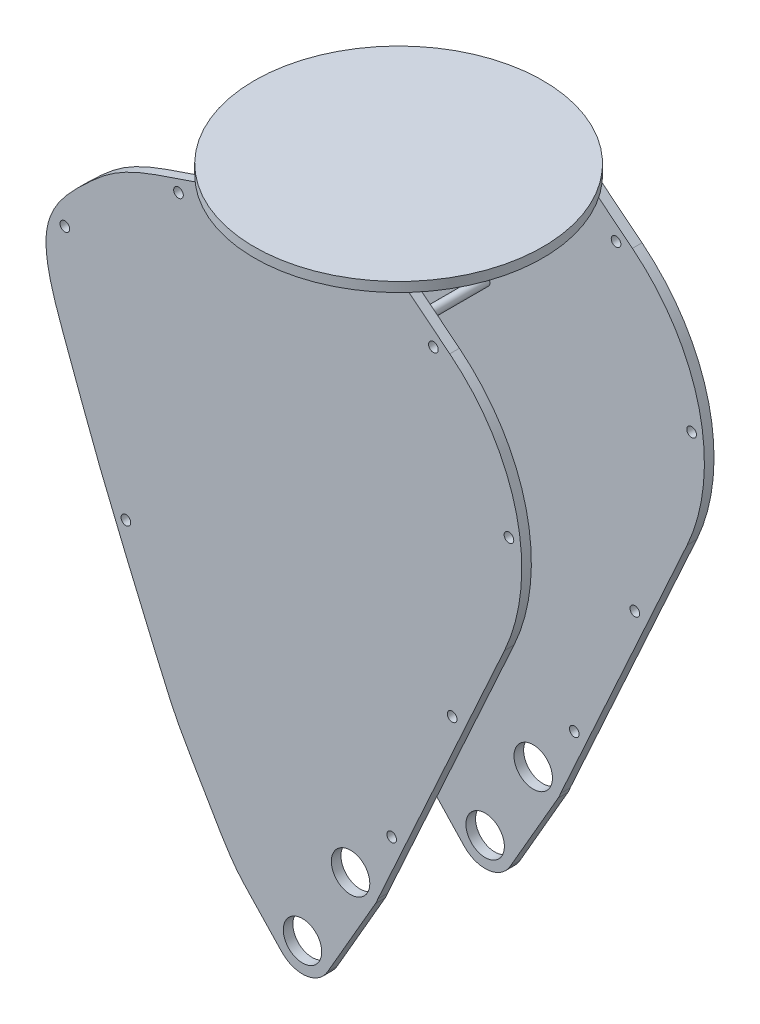
from build123d import *

# Parameters (mm, degrees)
SKETCH_1_R               = 10
EXTRUDE_1_DEPTH          = 100
EXTRUDE_START            = -100
SKETCH_2_R               = 10
EXTRUDE_2_DEPTH          = 100
EXTRUDE_6_DEPTH          = 100
CUT_EXTRUDE_1_DEPTH      = 547.260522505
CUT_EXTRUDE_1_DEPTH_BACK = 547.260522505
SKETCH_3_W               = 90
SKETCH_3_H               = 380
SKETCH_5_R               = 2.5
EXTRUDE_3_DEPTH          = 100
SKETCH_6_W               = 191.177045066
SKETCH_6_H               = 235.084722287
CUT_EXTRUDE_2_DEPTH      = 84
SKETCH_7_R               = 75
EXTRUDE_4_DEPTH          = 5
FILLET_1_R               = 100
CUT_EXTRUDE_3_DEPTH      = 372.245990354
CUT_EXTRUDE_3_DEPTH_BACK = 372.245990354
SKETCH_9_R               = 2.5


# Read off the part's stored shape, not the designer's step: 凸台-拉伸6
with BuildPart() as part:
    # 草图1 → 凸台-拉伸1 (new body)
    with BuildSketch(Plane.XY):
        with BuildLine():
            Line((-15, 500), (-15, 0))
            ThreePointArc((-15, 0), (0, -15), (15, 0))
            Line((15, 0), (15, 500))
            ThreePointArc((15, 500), (0, 515), (-15, 500))
        make_face()
        with Locations((0, 500)):
            Circle(SKETCH_1_R, mode=Mode.SUBTRACT)
        Circle(SKETCH_1_R, mode=Mode.SUBTRACT)
    extrude(amount=EXTRUDE_1_DEPTH)

    # 草图2 → 凸台-拉伸2 (add)
    with BuildSketch(Plane.XY.offset(100).offset(EXTRUDE_START)):
        with BuildLine():
            Line((15, 58.301270189), (25, 58.301270189))
            ThreePointArc((25, 58.301270189), (37.990381057, 50.801270189), (37.990381057, 35.801270189))
            Line((37.990381057, 35.801270189), (12.990381057, -7.5))
            ThreePointArc((12.990381057, -7.5), (-3.882285677, -14.488887394), (-15, 0))
            Line((-15, 0), (-15, 58.301270189))
            Line((-15, 58.301270189), (15, 58.301270189))
        make_face()
        with Locations((25, 43.301270189)):
            Circle(SKETCH_2_R, mode=Mode.SUBTRACT)
        Circle(SKETCH_2_R, mode=Mode.SUBTRACT)
    extrude(amount=EXTRUDE_2_DEPTH)

    # 凸台-拉伸6 outline → 凸台-拉伸6 (add)
    with BuildSketch(Plane(origin=(0, 0, 0), x_dir=(-1, 0, 0), z_dir=(0, 0, -1)).offset(EXTRUDE_START)):
        with BuildLine():
            add(Edge.make_bspline(
                [(38.612780637, 320), (75.136043423, 306.586029444), (91.064136582, 304.603219665), (118.984001014, 278.973676733), (129.662077412, 267.968974065), (136.038640467, 242.70657755), (120.359514298, 200.44999402), (109.589031887, 171.214421453), (103.269394168, 155.375414082), (89.549210595, 121.677121722), (65.725886592, 66.828536865), (62.106981873, 60.722826423), (38.372965569, 20.119833015), (32.80466093, 12.939929061), (30.288618585, 10.269952061)],
                knots=[0, 0, 0, 0, 0.244208219, 0.271127101, 0.397158822, 0.431429532, 0.59808024, 0.828922037, 0.865497992, 0.952912921, 0.966817851, 0.990642362, 0.993870231, 0.996118484, 0.996118484, 0.996118484, 0.996118484], degree=3))
            Line((38.612780637, 320), (15, 320))
            Line((15, 320), (15, 0))
            ThreePointArc((15, 0), (13.941832406, -5.534013839), (10.916625444, -10.28723913))
            Line((10.916625444, -10.28723913), (30.288618585, 10.269952061))
        make_face()
        with BuildLine():
            Line((-15, 58.301270189), (-15, 320))
            Line((-15, 320), (-55, 320))
            Line((-55, 320), (-137.235207142, 254.038677195))
            Line((-137.235207142, 254.038677195), (-39.190607966, 38.440545392))
            ThreePointArc((-39.190607966, 38.440545392), (-37.204730066, 52.021623624), (-25, 58.301270189))
            Line((-25, 58.301270189), (-15, 58.301270189))
        make_face()
    extrude(amount=EXTRUDE_6_DEPTH)

    # 草图3 → 切除-拉伸1 (cut, two sides: drawn at the far end of the back side and taken through both)
    with BuildSketch(Plane.ZY.offset(15).offset(-CUT_EXTRUDE_1_DEPTH_BACK)):
        with Locations((50, 150)):
            Rectangle(SKETCH_3_W, SKETCH_3_H)
    extrude(amount=CUT_EXTRUDE_1_DEPTH + CUT_EXTRUDE_1_DEPTH_BACK, mode=Mode.SUBTRACT)

    # 草图5 → 凸台-拉伸3 (add)
    with BuildSketch(Plane.XY.offset(100)):
        with Locations(Location((0, 250, 0), (0, 0, 270))):
            Circle(SKETCH_5_R)
    extrude(amount=-EXTRUDE_3_DEPTH)

    # 草图6 → 切除-拉伸2 (cut)
    with BuildSketch(Plane(origin=(15, 0, 0), x_dir=(0, 0, -1), z_dir=(1, 0, 0))):
        with Locations((-50.962374235, 437.542361144)):
            Rectangle(SKETCH_6_W, SKETCH_6_H)
    extrude(amount=-CUT_EXTRUDE_2_DEPTH, mode=Mode.SUBTRACT)

    # 草图7 → 凸台-拉伸4 (add)
    with BuildSketch(Plane(origin=(0, 320, 0), x_dir=(1, 0, 0), z_dir=(0, 1, 0))):
        with Locations(Location((0, -50, 0), (0, 0, 180))):
            Circle(SKETCH_7_R)
    extrude(amount=EXTRUDE_4_DEPTH)

    # 圆角1
    fillet_1_edges = [part.edges().sort_by_distance(p)[0] for p in [
        (137.235207142, 254.038677195, 97.5),
        (137.235207142, 254.038677195, 2.5),
    ]]
    fillet(fillet_1_edges, radius=FILLET_1_R)

    # 草图9 → 切除-拉伸3 (cut, two sides: drawn at the far end of the back side and taken through both)
    with BuildSketch(Plane.XY.offset(5).offset(-CUT_EXTRUDE_3_DEPTH_BACK)):
        with Locations((68.070503846, 301.488779743)):
            Circle(SKETCH_9_R)
        with Locations((77.830342663, 139.909225997)):
            Circle(SKETCH_9_R)
        with Locations((46.381973142, 69.963714477)):
            Circle(SKETCH_9_R)
        with Locations((-91.856835643, 143.592106289)):
            Circle(SKETCH_9_R)
        with Locations((-123.601886252, 260.009464772)):
            Circle(SKETCH_9_R)
        with Locations((-64.500640083, 304.742059349)):
            Circle(SKETCH_9_R)
        with Locations((107.380965747, 235.338761096)):
            Circle(SKETCH_9_R)
    extrude(amount=CUT_EXTRUDE_3_DEPTH + CUT_EXTRUDE_3_DEPTH_BACK, mode=Mode.SUBTRACT)


solid = part.part
